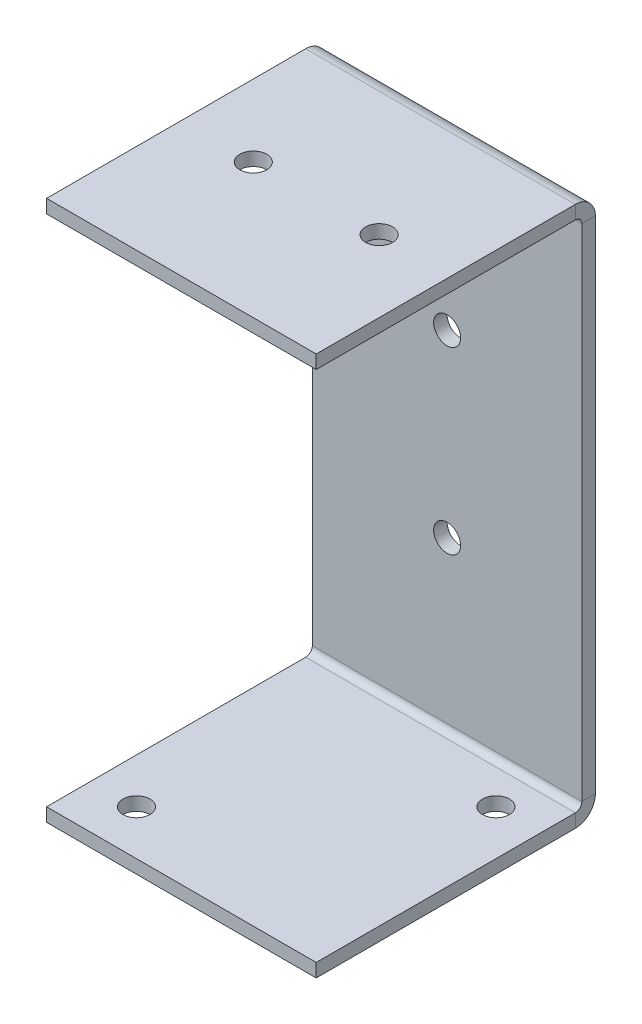
from build123d import *

# Parameters (mm, degrees)
SKETCH1_W                       = 30
SKETCH1_H                       = 118
SKETCH1_R                       = 1.5
BASE_FLANGE1_DEPTH              = 1.5
SKETCHED_BEND1_DEPTH            = 30
SKETCHED_START                  = 9.5000001
SKETCHED_BEND1_2_DEPTH          = 10.9999998
SKETCHED_BEND1_3_DEPTH          = 6.4999999
SKETCHED_START_2                = 23.5000001
SKETCHED_BEND1_4_DEPTH          = 6.4999999
SKETCHED_START_3                = 6.4999999
SKETCHED_BEND1_5_DEPTH          = 17.0000002
SKETCHED_START_4                = 57.138054181
SKETCHED_BEND1_6_OUTLINE_R      = 1.5
SKETCHED_BEND1_6_DEPTH          = 1.5
F_3_0MM_PRESS_DOWEL_HOLE1_D     = 3
F_3_0MM_PRESS_DOWEL_HOLE1_DEPTH = 6
F_3_0MM_PRESS_DOWEL_HOLE1_TIP   = 0.901290929
F_3_0MM_PRESS_DOWEL_HOLE2_D     = 3


with BuildPart() as part:
    # Base-Flange1: sheet metal written as solids
    # Sketch1 → Base-Flange1 (new body)
    with BuildSketch(Plane(origin=(0, 0, 0), x_dir=(1, 0, 0), z_dir=(0, 1, 0))):
        with Locations((15, 59)):
            Rectangle(SKETCH1_W, SKETCH1_H)
        with Locations(Location((8, 103, 0), (0, 0, 270))):
            Circle(SKETCH1_R, mode=Mode.SUBTRACT)
        with Locations(Location((22, 103, 0), (0, 0, 270))):
            Circle(SKETCH1_R, mode=Mode.SUBTRACT)
        with Locations(Location((25, 25, 0), (0, 0, 270))):
            Circle(SKETCH1_R, mode=Mode.SUBTRACT)
        with Locations(Location((5, 5, 0), (0, 0, 270))):
            Circle(SKETCH1_R, mode=Mode.SUBTRACT)
    extrude(amount=-BASE_FLANGE1_DEPTH)

    # Sketched Bend1: read off the stored shape, not the designer's step
    # Sketched Bend1 outline → Sketched Bend1 (cut)
    with BuildSketch(Plane.YZ):
        with BuildLine():
            Line((0, -118), (0, -30.944250946))
            ThreePointArc((0, -30.944250946), (-1.086838938, -30.127591172), (-1.5, -28.83242709))
            Line((-1.5, -28.83242709), (-1.5, -118))
            Line((-1.5, -118), (0, -118))
        make_face()
    extrude(amount=SKETCHED_BEND1_DEPTH, mode=Mode.SUBTRACT)

    # Sketched Bend1 2 outline → Sketched Bend1 2 (add)
    with BuildSketch(Plane.YZ.offset(SKETCHED_START)):
        with BuildLine():
            Line((56.401454181, -29.56902709), (0.7366, -29.56902709))
            ThreePointArc((0.7366, -29.56902709), (0.215745145, -29.353281945), (0, -28.83242709))
            Line((0, -28.83242709), (0, -30.944250946))
            ThreePointArc((0, -30.944250946), (0.363053267, -31.037612433), (0.7366, -31.06902709))
            Line((0.7366, -31.06902709), (56.401454181, -31.06902709))
            ThreePointArc((56.401454181, -31.06902709), (57.982969207, -30.413942116), (58.638054181, -28.83242709))
            Line((58.638054181, -28.83242709), (58.638054181, 0))
            Line((58.638054181, 0), (57.138054181, 0))
            Line((57.138054181, 0), (57.138054181, -28.83242709))
            ThreePointArc((57.138054181, -28.83242709), (56.922309036, -29.353281945), (56.401454181, -29.56902709))
        make_face()
    extrude(amount=SKETCHED_BEND1_2_DEPTH)

    # Sketched Bend1 3 outline → Sketched Bend1 3 (add)
    with BuildSketch(Plane.YZ):
        with BuildLine():
            Line((56.401454181, -29.56902709), (0.7366, -29.56902709))
            ThreePointArc((0.7366, -29.56902709), (0.215745145, -29.353281945), (0, -28.83242709))
            Line((0, -28.83242709), (0, -30.944250946))
            ThreePointArc((0, -30.944250946), (0.363053267, -31.037612433), (0.7366, -31.06902709))
            Line((0.7366, -31.06902709), (56.401454181, -31.06902709))
            ThreePointArc((56.401454181, -31.06902709), (57.982969207, -30.413942116), (58.638054181, -28.83242709))
            Line((58.638054181, -28.83242709), (58.638054181, 0))
            Line((58.638054181, 0), (57.138054181, 0))
            Line((57.138054181, 0), (57.138054181, -28.83242709))
            ThreePointArc((57.138054181, -28.83242709), (56.922309036, -29.353281945), (56.401454181, -29.56902709))
        make_face()
    extrude(amount=SKETCHED_BEND1_3_DEPTH)

    # Sketched Bend1 4 outline → Sketched Bend1 4 (add)
    with BuildSketch(Plane.YZ.offset(SKETCHED_START_2)):
        with BuildLine():
            Line((56.401454181, -29.56902709), (0.7366, -29.56902709))
            ThreePointArc((0.7366, -29.56902709), (0.215745145, -29.353281945), (0, -28.83242709))
            Line((0, -28.83242709), (0, -30.944250946))
            ThreePointArc((0, -30.944250946), (0.363053267, -31.037612433), (0.7366, -31.06902709))
            Line((0.7366, -31.06902709), (56.401454181, -31.06902709))
            ThreePointArc((56.401454181, -31.06902709), (57.982969207, -30.413942116), (58.638054181, -28.83242709))
            Line((58.638054181, -28.83242709), (58.638054181, 0))
            Line((58.638054181, 0), (57.138054181, 0))
            Line((57.138054181, 0), (57.138054181, -28.83242709))
            ThreePointArc((57.138054181, -28.83242709), (56.922309036, -29.353281945), (56.401454181, -29.56902709))
        make_face()
    extrude(amount=SKETCHED_BEND1_4_DEPTH)

    # Sketched Bend1 5 outline → Sketched Bend1 5 (add)
    with BuildSketch(Plane.YZ.offset(SKETCHED_START_3)):
        with BuildLine():
            Line((56.401454181, -29.56902709), (0.7366, -29.56902709))
            ThreePointArc((0.7366, -29.56902709), (0.215745145, -29.353281945), (0, -28.83242709))
            Line((0, -28.83242709), (0, -30.944250946))
            ThreePointArc((0, -30.944250946), (0.363053267, -31.037612433), (0.7366, -31.06902709))
            Line((0.7366, -31.06902709), (56.401454181, -31.06902709))
            ThreePointArc((56.401454181, -31.06902709), (57.982969207, -30.413942116), (58.638054181, -28.83242709))
            Line((58.638054181, -28.83242709), (58.638054181, 0))
            Line((58.638054181, 0), (57.138054181, 0))
            Line((57.138054181, 0), (57.138054181, -28.83242709))
            ThreePointArc((57.138054181, -28.83242709), (56.922309036, -29.353281945), (56.401454181, -29.56902709))
        make_face()
    extrude(amount=SKETCHED_BEND1_5_DEPTH)

    # Sketched Bend1 6 outline → Sketched Bend1 6 (cut)
    with BuildSketch(Plane(origin=(0, 0, 0), x_dir=(1, 0, 0), z_dir=(0, 1, 0)).offset(SKETCHED_START_4)):
        with Locations((8, 15)):
            Circle(SKETCHED_BEND1_6_OUTLINE_R)
        with Locations((22, 15)):
            Circle(SKETCHED_BEND1_6_OUTLINE_R)
    extrude(amount=SKETCHED_BEND1_6_DEPTH, mode=Mode.SUBTRACT)

    # Ø3.0mm Press Dowel Hole1
    with Locations(Plane(origin=(-227.525513363, -7.5, -157.600386311), x_dir=(1, 0, 0), z_dir=(0, -1, 0))):
        with Locations((220.525513363, 156.531359221), (102.525513363, 181.531359221), (102.525513363, 271.531359221), (89.19270005, 226.531359221), (210.525513363, 317.793651488), (230.525513363, 317.793651488), (252.525513363, 320.462332131), (232.525513363, 300.462332131), (252.525513363, 132.600386311), (232.525513363, 152.600386311), (111.286271896, 136.531359221), (91.286271896, 136.531359221), (41.525513363, 196.432813402), (13.525513363, 196.432813402), (41.525513363, 138.767959221), (13.525513363, 138.767959221), (41.525513363, 256.62990504), (13.525513363, 256.62990504), (41.525513363, 314.294759221), (13.525513363, 314.294759221)):
            Hole(F_3_0MM_PRESS_DOWEL_HOLE1_D / 2, depth=F_3_0MM_PRESS_DOWEL_HOLE1_DEPTH)
            with Locations((0, 0, -(F_3_0MM_PRESS_DOWEL_HOLE1_DEPTH + F_3_0MM_PRESS_DOWEL_HOLE1_TIP / 2))):  # 118° drill point
                Cone(0, F_3_0MM_PRESS_DOWEL_HOLE1_D / 2, F_3_0MM_PRESS_DOWEL_HOLE1_TIP, mode=Mode.SUBTRACT)

    # Ø3.0mm Press Dowel Hole2 (through all)
    with Locations(Plane(origin=(0, 0, -31.06902709), x_dir=(-1, 0, 0), z_dir=(0, 0, -1))):
        with Locations((-15, 38.638054181), (-15, 18.638054181)):
            Hole(F_3_0MM_PRESS_DOWEL_HOLE2_D / 2)


solid = part.part
